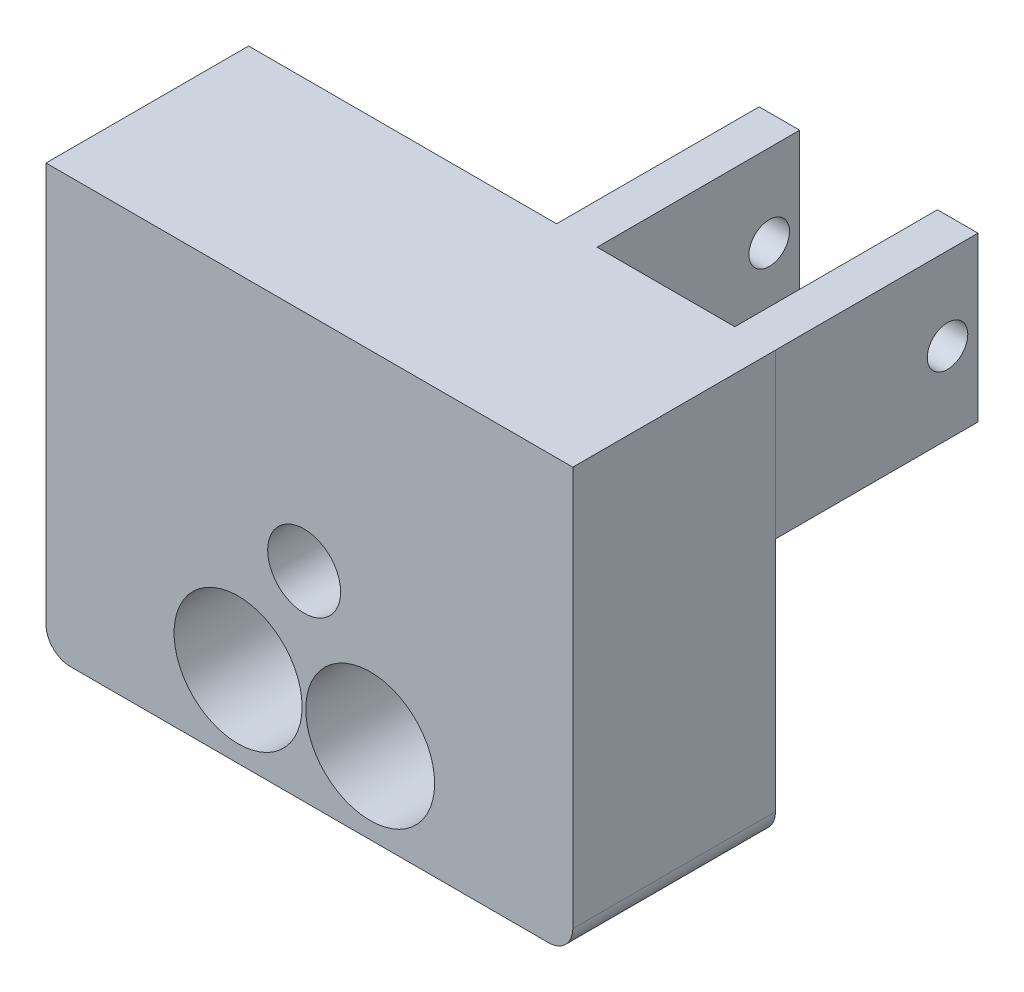
from build123d import *

# Parameters (mm, degrees)
ESQUISSE1_W              = 105
ESQUISSE1_H              = 80
BOSS_EXTRU_1_DEPTH       = 25
ESQUISSE2_R              = 7.9
ESQUISSE2_R_2            = 7.95
ESQUISSE2_R_3            = 4.5
ENL_V_MAT_EXTRU_1_DEPTH  = 135.350288425
ESQUISSE3_R              = 4
ENL_V_MAT_EXTRU_3_DEPTH  = 10
ESQUISSE6_W              = 40
ESQUISSE6_H              = 80
ENL_V_MAT_EXTRU_6_DEPTH  = 135.350288425
ESQUISSE7_W              = 65
ESQUISSE7_H              = 2.68813313
ENL_V_MAT_EXTRU_7_DEPTH  = 135.350288425
CONG_1_R                 = 3
ESQUISSE9_W              = 5
ESQUISSE9_H              = 20.179429856
ESQUISSE9_H_2            = 20.18
BOSS_EXTRU_2_DEPTH       = 25
ESQUISSE10_R             = 2.5
ENL_V_MAT_EXTRU_8_DEPTH  = 105.048287139
ENL_V_MAT_EXTRU_9_DEPTH  = 7.5
ENL_V_MAT_EXTRU_11_DEPTH = 133.767182537


with BuildPart() as part:
    # Esquisse1 → Boss.-Extru.1 (new body)
    with BuildSketch(Plane.XY):
        with Locations((52.5, 40)):
            Rectangle(ESQUISSE1_W, ESQUISSE1_H)
    extrude(amount=BOSS_EXTRU_1_DEPTH)

    # Esquisse2 → Enlèv. mat.-Extru.1 (cut, through all)
    with BuildSketch(Plane.XY):
        with Locations((63.7, 10)):
            Circle(ESQUISSE2_R)
        with Locations((80, 10)):
            Circle(ESQUISSE2_R_2)
        with Locations((71.85, 24.633523157)):
            Circle(ESQUISSE2_R_3)
    extrude(amount=ENL_V_MAT_EXTRU_1_DEPTH, mode=Mode.SUBTRACT)

    # Esquisse3 → Enlèv. mat.-Extru.3 (cut)
    with BuildSketch(Plane(origin=(0, 0, 0), x_dir=(1, 0, 0), z_dir=(0, 1, 0))):
        with Locations((49, -12.5)):
            Circle(ESQUISSE3_R)
        with Locations((93, -12.5)):
            Circle(ESQUISSE3_R)
    extrude(amount=ENL_V_MAT_EXTRU_3_DEPTH, mode=Mode.SUBTRACT)

    # Esquisse6 → Enlèv. mat.-Extru.6 (cut, through all)
    with BuildSketch(Plane.XY):
        with Locations((20, 40)):
            Rectangle(ESQUISSE6_W, ESQUISSE6_H)
    extrude(amount=ENL_V_MAT_EXTRU_6_DEPTH, mode=Mode.SUBTRACT)

    # Esquisse7 → Enlèv. mat.-Extru.7 (cut, through all)
    with BuildSketch(Plane.XY):
        with Locations((72.5, 78.655933435)):
            Rectangle(ESQUISSE7_W, ESQUISSE7_H)
    extrude(amount=ENL_V_MAT_EXTRU_7_DEPTH, mode=Mode.SUBTRACT)

    # Congé1
    cong_1_edges = [part.edges().sort_by_distance(p)[0] for p in [
        (105, 77.31186687, 12.5),
        (40, 77.31186687, 12.5),
        (40, 0, 12.5),
        (105, 0, 12.5),
    ]]
    fillet(cong_1_edges, radius=CONG_1_R)

    # Esquisse9 → Boss.-Extru.2 (add)
    with BuildSketch(Plane.XY):
        with Locations((102.49170176, 42.222151942)):
            Rectangle(ESQUISSE9_W, ESQUISSE9_H)
        with Locations((80.49170176, 42.22186687)):
            Rectangle(ESQUISSE9_W, ESQUISSE9_H_2)
    extrude(amount=-BOSS_EXTRU_2_DEPTH)

    # Esquisse10 → Enlèv. mat.-Extru.8 (cut, through all)
    with BuildSketch(Plane(origin=(104.99170176, 0, 0), x_dir=(0, 0, -1), z_dir=(1, 0, 0))):
        with Locations((21.24, 42.132437014)):
            Circle(ESQUISSE10_R)
    extrude(amount=-ENL_V_MAT_EXTRU_8_DEPTH, mode=Mode.SUBTRACT)

    # Esquisse11 → Enlèv. mat.-Extru.9 (cut)
    with BuildSketch(Plane(origin=(0, 0, 0), x_dir=(-1, 0, 0), z_dir=(0, 0, -1))):
        Polygon((-73.38169787, 32.15796566), (-79.132207291, 27.069255143), (-77.600509422, 19.54481264), (-70.31830213, 17.109080655), (-64.567792709, 22.197791172), (-66.099490578, 29.722233675), align=None)
    extrude(amount=-ENL_V_MAT_EXTRU_9_DEPTH, mode=Mode.SUBTRACT)

    # Esquisse12 → Enlèv. mat.-Extru.11 (cut, through all)
    with BuildSketch(Plane(origin=(0, 0, 0), x_dir=(-1, 0, 0), z_dir=(0, 0, -1))):
        Polygon((-105.676011247, 77.330619324), (-105.676011247, 52.31186687), (-104.99170176, 52.31186687), (-39.98533212, 52.31186687), (-39.98533212, 77.330619324), (-104.99170176, 77.330619324), align=None)
    extrude(amount=-ENL_V_MAT_EXTRU_11_DEPTH, mode=Mode.SUBTRACT)


solid = part.part
